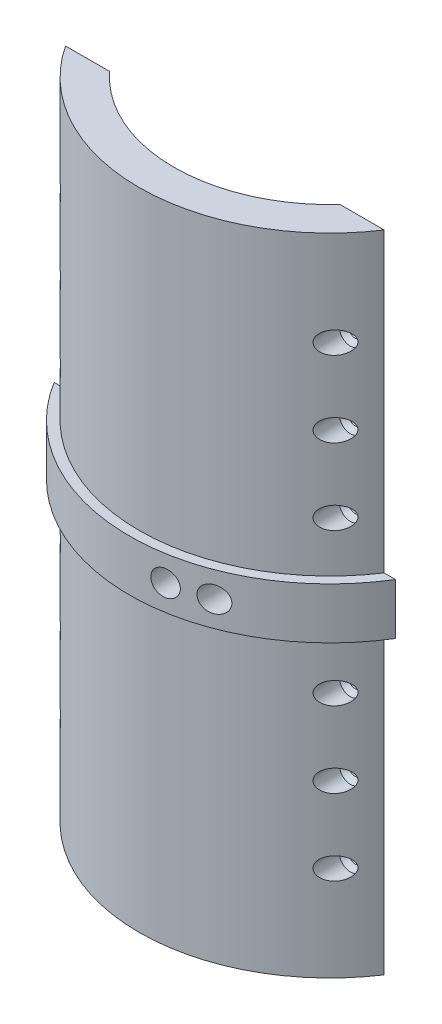
from build123d import *

# Parameters (mm, degrees)
BOSS_EXTRUDE1_DEPTH      = 170
LPATTERN1_COUNT          = 7
LPATTERN1_PITCH          = 20
BOSS_EXTRUDE2_DEPTH      = 6.731
BOSS_EXTRUDE2_DEPTH_BACK = 6.731
SKETCH9_R                = 3.334469726
CUT_EXTRUDE1_DEPTH       = 34


with BuildPart() as part:
    # Sketch1 → Boss-Extrude1 (new body)
    with BuildSketch(Plane(origin=(60.535204745, 0, -85.948449604), x_dir=(1, 0, 0), z_dir=(0, 1, 0))):
        with BuildLine():
            ThreePointArc((-30.186446753, -113.644462538), (-60.535204745, -127.035141416), (-90.883962736, -113.644462538))
            Line((-90.883962736, -113.644462538), (-102.513962844, -113.644462538))
            ThreePointArc((-102.513962844, -113.644462538), (-60.535204745, -136.240449604), (-18.556446645, -113.644462538))
            Line((-18.556446645, -113.644462538), (-30.186446753, -113.644462538))
        make_face()
    extrude(amount=BOSS_EXTRUDE1_DEPTH)

    # Sketch6 → Cut-Revolve4 (revolve, cut)
    with BuildSketch(Plane(origin=(36.163758045, 25, 27.696012934), x_dir=(-1, 0, 0), z_dir=(0, -1, 0))):
        Polygon((0, 1.685394277), (0, -4.78184701), (0, -15.185924704), (-2.9, -15.185924704), (-2.9, -3.079025683), (-1.65, -1.881964943), (-1.65, 1.685394277), align=None)
    cut_revolve4 = revolve(axis=Axis((36.163758045, 25, 26.010618657), (0, 0, 1)), mode=Mode.SUBTRACT)

    # LPattern1: Cut-Revolve4 ×7
    with Locations(*[(0, i * LPATTERN1_PITCH, 0) for i in range(1, LPATTERN1_COUNT)]):
        add(cut_revolve4, mode=Mode.SUBTRACT)

    # Mirror1: Cut-Revolve4 across plane
    add(cut_revolve4.mirror(Plane(origin=(0, 0, 0), x_dir=(0, 0, 1), z_dir=(1, 0, 0))), mode=Mode.SUBTRACT)

    # Mirror1 copy 1 sketch → Mirror1 copy 1 (revolve, cut)
    with BuildSketch(Plane(origin=(-36.163758045, 45, 27.696012934), x_dir=(1, 0, 0), z_dir=(0, -1, 0))):
        Polygon((0, -1.685394277), (0, 4.78184701), (0, 15.185924704), (-2.9, 15.185924704), (-2.9, 3.079025683), (-1.65, 1.881964943), (-1.65, -1.685394277), align=None)
    revolve(axis=Axis((-36.163758045, 45, 26.010618657), (0, 0, -1)), mode=Mode.SUBTRACT)

    # Mirror1 copy 2 sketch → Mirror1 copy 2 (revolve, cut)
    with BuildSketch(Plane(origin=(-36.163758045, 65, 27.696012934), x_dir=(1, 0, 0), z_dir=(0, -1, 0))):
        Polygon((0, -1.685394277), (0, 4.78184701), (0, 15.185924704), (-2.9, 15.185924704), (-2.9, 3.079025683), (-1.65, 1.881964943), (-1.65, -1.685394277), align=None)
    revolve(axis=Axis((-36.163758045, 65, 26.010618657), (0, 0, -1)), mode=Mode.SUBTRACT)

    # Mirror1 copy 3 sketch → Mirror1 copy 3 (revolve, cut)
    with BuildSketch(Plane(origin=(-36.163758045, 85, 27.696012934), x_dir=(1, 0, 0), z_dir=(0, -1, 0))):
        Polygon((0, -1.685394277), (0, 4.78184701), (0, 15.185924704), (-2.9, 15.185924704), (-2.9, 3.079025683), (-1.65, 1.881964943), (-1.65, -1.685394277), align=None)
    revolve(axis=Axis((-36.163758045, 85, 26.010618657), (0, 0, -1)), mode=Mode.SUBTRACT)

    # Mirror1 copy 4 sketch → Mirror1 copy 4 (revolve, cut)
    with BuildSketch(Plane(origin=(-36.163758045, 105, 27.696012934), x_dir=(1, 0, 0), z_dir=(0, -1, 0))):
        Polygon((0, -1.685394277), (0, 4.78184701), (0, 15.185924704), (-2.9, 15.185924704), (-2.9, 3.079025683), (-1.65, 1.881964943), (-1.65, -1.685394277), align=None)
    revolve(axis=Axis((-36.163758045, 105, 26.010618657), (0, 0, -1)), mode=Mode.SUBTRACT)

    # Mirror1 copy 5 sketch → Mirror1 copy 5 (revolve, cut)
    with BuildSketch(Plane(origin=(-36.163758045, 125, 27.696012934), x_dir=(1, 0, 0), z_dir=(0, -1, 0))):
        Polygon((0, -1.685394277), (0, 4.78184701), (0, 15.185924704), (-2.9, 15.185924704), (-2.9, 3.079025683), (-1.65, 1.881964943), (-1.65, -1.685394277), align=None)
    revolve(axis=Axis((-36.163758045, 125, 26.010618657), (0, 0, -1)), mode=Mode.SUBTRACT)

    # Mirror1 copy 6 sketch → Mirror1 copy 6 (revolve, cut)
    with BuildSketch(Plane(origin=(-36.163758045, 145, 27.696012934), x_dir=(1, 0, 0), z_dir=(0, -1, 0))):
        Polygon((0, -1.685394277), (0, 4.78184701), (0, 15.185924704), (-2.9, 15.185924704), (-2.9, 3.079025683), (-1.65, 1.881964943), (-1.65, -1.685394277), align=None)
    revolve(axis=Axis((-36.163758045, 145, 26.010618657), (0, 0, -1)), mode=Mode.SUBTRACT)

    # Sketch7 → Boss-Extrude2 (add, two sides: drawn at the far end of the back side and taken through both)
    with BuildSketch(Plane(origin=(0, 85, 0), x_dir=(-1, 0, 0), z_dir=(0, -1, 0)).offset(-BOSS_EXTRUDE2_DEPTH_BACK)):
        with BuildLine():
            Line((-44.990566695, -27.696012934), (-41.978758099, -27.696012934))
            ThreePointArc((-41.978758099, -27.696012934), (0, -50.292), (41.978758099, -27.696012934))
            Line((41.978758099, -27.696012934), (44.990566695, -27.696012934))
            ThreePointArc((44.990566695, -27.696012934), (0, -52.832), (-44.990566695, -27.696012934))
        make_face()
    extrude(amount=BOSS_EXTRUDE2_DEPTH + BOSS_EXTRUDE2_DEPTH_BACK)

    # Sketch9 → Cut-Extrude1 (cut)
    with BuildSketch(Plane(origin=(0, 0, 27.696012934), x_dir=(-1, 0, 0), z_dir=(0, 0, -1))):
        with Locations((-18.801989508, 85)):
            Circle(SKETCH9_R)
        with Locations((-8.69556827, 85)):
            Circle(SKETCH9_R)
    extrude(amount=-CUT_EXTRUDE1_DEPTH, mode=Mode.SUBTRACT)


solid = part.part
